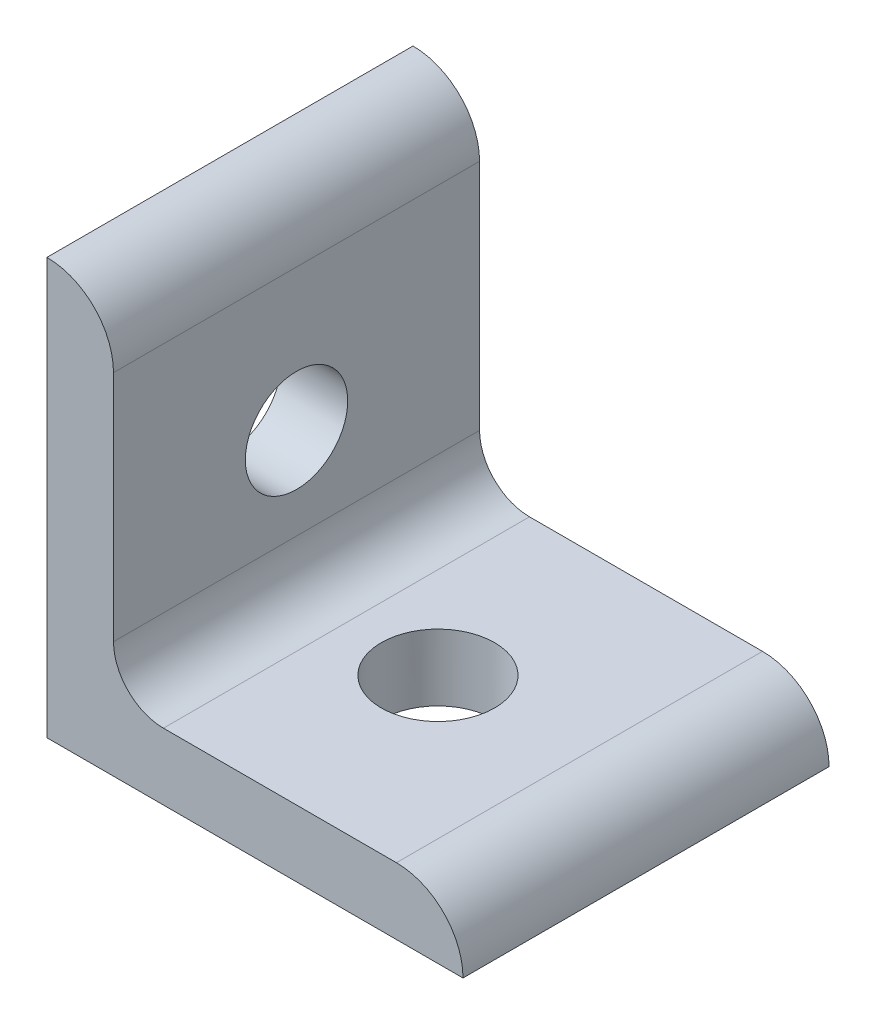
from build123d import *

# Parameters (mm, degrees)
BOSS_EXTRUDE1_DEPTH = 10.9982
FILLET1_R           = 4
FILLET2_R           = 3
CUT_EXTRUDE1_REACH  = 39.026
SKETCH2_R           = 3.4036
CUT_EXTRUDE2_REACH  = 39.026
SKETCH4_R           = 3.075953135


with BuildPart() as part:
    # Sketch1 → Boss-Extrude1 (new, symmetric)
    with BuildSketch(Plane.XY):
        Polygon((0, 0), (0, 25), (4, 25), (4, 4), (25, 4), (25, 0), align=None)
    extrude(amount=BOSS_EXTRUDE1_DEPTH, both=True)

    # Fillet1
    fillet1_edges = [part.edges().sort_by_distance(p)[0] for p in [
        (25, 4, 0),
        (4, 25, 0),
    ]]
    fillet(fillet1_edges, radius=FILLET1_R - 0.0001)  # a hair under: the kernel refuses the full size

    # Fillet2
    fillet2_edges = [part.edges().sort_by_distance(p)[0] for p in [
        (4, 4, 0),
    ]]
    fillet(fillet2_edges, radius=FILLET2_R)

    # Sketch2 → Cut-Extrude1 (cut, up to next)
    with BuildSketch(Plane.XZ, mode=Mode.PRIVATE) as cut_extrude1_sk1:
        with Locations((12.4968, 0)):
            Circle(SKETCH2_R)
    cut_extrude1_tool1 = extrude(cut_extrude1_sk1.sketch, amount=-CUT_EXTRUDE1_REACH, mode=Mode.PRIVATE) & part.part
    add(cut_extrude1_tool1.solids().sort_by_distance((12.4968, 0, 0))[0], mode=Mode.SUBTRACT)

    # Sketch4 → Cut-Extrude2 (cut, up to next)
    with BuildSketch(Plane.ZY, mode=Mode.PRIVATE) as cut_extrude2_sk1:
        with Locations((0, 12.4968)):
            Circle(SKETCH4_R)
    cut_extrude2_tool1 = extrude(cut_extrude2_sk1.sketch, amount=-CUT_EXTRUDE2_REACH, mode=Mode.PRIVATE) & part.part
    add(cut_extrude2_tool1.solids().sort_by_distance((0, 12.4968, 0))[0], mode=Mode.SUBTRACT)


solid = part.part
